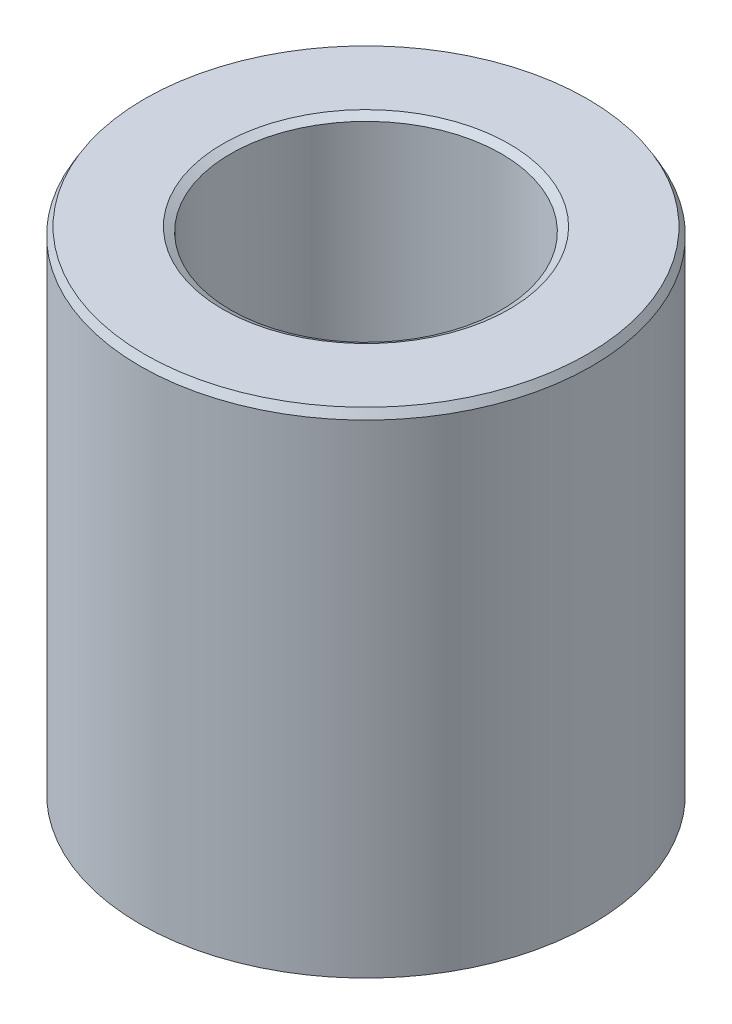
from build123d import *
from OCP.BRepFilletAPI import BRepFilletAPI_MakeChamfer

# Parameters (mm, degrees)
SKETCH1_R           = 55
BOSS_EXTRUDE1_DEPTH = 120.694779406
SKETCH2_R           = 32.955550251
CUT_EXTRUDE1_DEPTH  = 144.587011167
CHAMFER1_SIZE       = 1.928322986
CHAMFER1_SIZE2      = 1.113317795


with BuildPart() as part:
    # Sketch1 → Boss-Extrude1 (new body)
    with BuildSketch(Plane(origin=(0, 0, 0), x_dir=(1, 0, 0), z_dir=(0, 1, 0))):
        Circle(SKETCH1_R)
    extrude(amount=BOSS_EXTRUDE1_DEPTH)

    # Sketch2 → Cut-Extrude1 (cut, through all)
    with BuildSketch(Plane(origin=(0, 0, 0), x_dir=(1, 0, 0), z_dir=(0, 1, 0))):
        Circle(SKETCH2_R)
    extrude(amount=CUT_EXTRUDE1_DEPTH, mode=Mode.SUBTRACT)

    # Chamfer1: one chamfer whose edges measure the first distance from different faces: ONE call of the kernel's chamfer builder (chamfer() names one face for all edges)
    chamfer1_edges_1 = [part.edges().sort_by_distance(p)[0] for p in [
        (-32.955550251, 120.694779406, 0),
    ]]
    chamfer1_side_1 = [part.faces().sort_by_distance(p)[0] for p in [
        (-53.444365081, 120.694779406, 0),
    ]]
    chamfer1_edges_2 = [part.edges().sort_by_distance(p)[0] for p in [
        (-32.955550251, 0, 0),
    ]]
    chamfer1_side_2 = [part.faces().sort_by_distance(p)[0] for p in [
        (-32.955550251, 60.347389703, 0),
    ]]
    chamfer1_edges_3 = [part.edges().sort_by_distance(p)[0] for p in [
        (-55, 0, 0),
    ]]
    chamfer1_side_3 = [part.faces().sort_by_distance(p)[0] for p in [
        (-53.444365081, 0, 0),
    ]]
    chamfer1_edges_4 = [part.edges().sort_by_distance(p)[0] for p in [
        (-55, 120.694779406, 0),
    ]]
    chamfer1_side_4 = [part.faces().sort_by_distance(p)[0] for p in [
        (-55, 60.347389703, 0),
    ]]
    chamfer1 = BRepFilletAPI_MakeChamfer(part.part.solid().wrapped)
    for e in chamfer1_edges_1:
        chamfer1.Add(CHAMFER1_SIZE, CHAMFER1_SIZE2, e.wrapped, chamfer1_side_1[0].wrapped)  # the first distance lies on this face
    for e in chamfer1_edges_2:
        chamfer1.Add(CHAMFER1_SIZE, CHAMFER1_SIZE2, e.wrapped, chamfer1_side_2[0].wrapped)  # the first distance lies on this face
    for e in chamfer1_edges_3:
        chamfer1.Add(CHAMFER1_SIZE, CHAMFER1_SIZE2, e.wrapped, chamfer1_side_3[0].wrapped)  # the first distance lies on this face
    for e in chamfer1_edges_4:
        chamfer1.Add(CHAMFER1_SIZE, CHAMFER1_SIZE2, e.wrapped, chamfer1_side_4[0].wrapped)  # the first distance lies on this face
    add(Compound.cast(chamfer1.Shape()), mode=Mode.REPLACE)


solid = part.part
